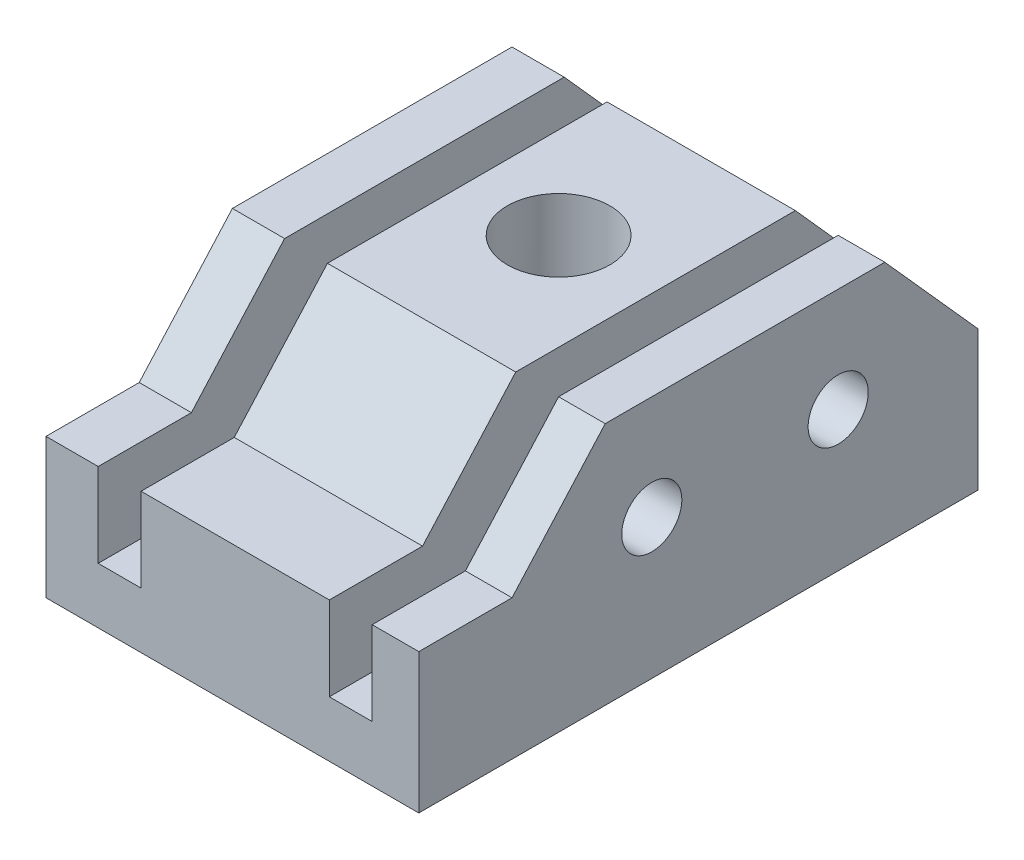
from build123d import *

# Parameters (mm, degrees)
SKETCH1_W           = 63.5
SKETCH1_H           = 6.35
BOSS_EXTRUDE1_DEPTH = 50.8
BOSS_EXTRUDE2_DEPTH = 50.8
SKETCH10_W          = 5.842
SKETCH10_H          = 25.629031657
CUT_EXTRUDE1_DEPTH  = 88.854357354
LPATTERN3_COUNT     = 2
LPATTERN3_PITCH     = 31.496
SKETCH11_R          = 4.09575
CUT_EXTRUDE2_DEPTH  = 88.854357354
BOSS_EXTRUDE3_DEPTH = 12.7
SKETCH23_R          = 6.985
CUT_EXTRUDE6_DEPTH  = 88.854357354
SKETCH24_W          = 22.86
SKETCH24_H          = 58.42
CUT_EXTRUDE7_DEPTH  = 4.58
SKETCH25_R          = 7
CUT_EXTRUDE8_DEPTH  = 2.799999956
SKETCH26_R          = 3
CUT_EXTRUDE9_DEPTH  = 10


with BuildPart() as part:
    # Sketch1 → Boss-Extrude1 (new body)
    with BuildSketch(Plane(origin=(0, 0, 0), x_dir=(0, 0, -1), z_dir=(1, 0, 0))):
        with Locations((31.75, 3.175)):
            Rectangle(SKETCH1_W, SKETCH1_H)
    extrude(amount=-BOSS_EXTRUDE1_DEPTH)

    # Sketch2 → Boss-Extrude2 (add)
    with BuildSketch(Plane(origin=(0, 0, 0), x_dir=(0, 0, -1), z_dir=(1, 0, 0))):
        Polygon((0, 6.35), (0, 19.05), (12.7, 33.249031657), (50.8, 33.249031657), (63.5, 19.05), (63.5, 6.35), align=None)
    extrude(amount=-BOSS_EXTRUDE2_DEPTH)

    # Sketch10 → Cut-Extrude1 (cut, through all)
    with BuildSketch(Plane(origin=(0, 0, -63.5), x_dir=(-1, 0, 0), z_dir=(0, 0, -1))):
        with Locations((9.271, 20.434515829)):
            Rectangle(SKETCH10_W, SKETCH10_H)
    cut_extrude1 = extrude(amount=-CUT_EXTRUDE1_DEPTH, mode=Mode.SUBTRACT)

    # LPattern3: Cut-Extrude1 ×2
    with Locations(*[(-i * LPATTERN3_PITCH, 0, 0) for i in range(1, LPATTERN3_COUNT)]):
        add(cut_extrude1, mode=Mode.SUBTRACT)

    # Sketch11 → Cut-Extrude2 (cut, through all)
    with BuildSketch(Plane(origin=(0, 0, 0), x_dir=(0, 0, -1), z_dir=(1, 0, 0))):
        with Locations((19.05, 19.05)):
            Circle(SKETCH11_R)
        with Locations((44.45, 19.05)):
            Circle(SKETCH11_R)
    extrude(amount=-CUT_EXTRUDE2_DEPTH, mode=Mode.SUBTRACT)

    # Sketch22 → Boss-Extrude3 (add)
    with BuildSketch(Plane.XY):
        Polygon((0, 0), (-50.8, 0), (-50.8, 7.62), (-50.8, 19.05), (-43.688, 19.05), (-43.688, 7.62), (-37.846, 7.62), (-37.846, 19.05), (-12.192, 19.05), (-12.192, 7.62), (-6.35, 7.62), (-6.35, 19.05), (0, 19.05), (0, 7.62), align=None)
    extrude(amount=BOSS_EXTRUDE3_DEPTH)

    # Sketch23 → Cut-Extrude6 (cut, through all)
    with BuildSketch(Plane(origin=(0, 33.249031657, 0), x_dir=(1, 0, 0), z_dir=(0, 1, 0))):
        with Locations((-25.4, 31.75)):
            Circle(SKETCH23_R)
    extrude(amount=-CUT_EXTRUDE6_DEPTH, mode=Mode.SUBTRACT)

    # Sketch24 → Cut-Extrude7 (cut)
    with BuildSketch(Plane.XZ):
        with Locations((-25.4, -21.59)):
            Rectangle(SKETCH24_W, SKETCH24_H)
    extrude(amount=-CUT_EXTRUDE7_DEPTH, mode=Mode.SUBTRACT)

    # Sketch25 → Cut-Extrude8 (cut)
    with BuildSketch(Plane.XZ.offset(-4.58)):
        with Locations((-25.4, -31.75)):
            Circle(SKETCH25_R)
    extrude(amount=-CUT_EXTRUDE8_DEPTH, mode=Mode.SUBTRACT)

    # Sketch26 → Cut-Extrude9 (cut)
    with BuildSketch(Plane(origin=(0, 4.58, 0), x_dir=(-1, 0, 0), z_dir=(0, -1, 0))):
        with Locations((30.4, 46.15)):
            Circle(SKETCH26_R)
        with Locations((20.4, 46.15)):
            Circle(SKETCH26_R)
        with Locations((20.4, -1.89703266)):
            Circle(SKETCH26_R)
        with Locations((30.4, -1.89703266)):
            Circle(SKETCH26_R)
    extrude(amount=-CUT_EXTRUDE9_DEPTH, mode=Mode.SUBTRACT)


solid = part.part
